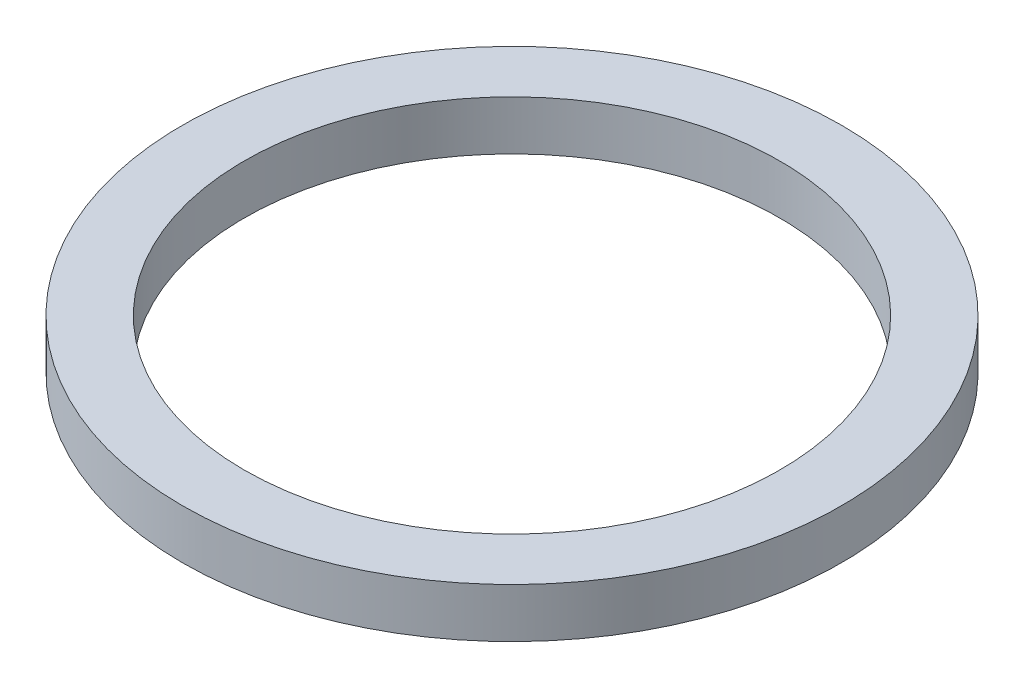
from build123d import *

# Parameters (mm, degrees)
SKETCH1_R           = 40
BOSS_EXTRUDE1_DEPTH = 6
SKETCH2_R           = 32.5
CUT_EXTRUDE1_DEPTH  = 57.885850613


with BuildPart() as part:
    # Sketch1 → Boss-Extrude1 (new body)
    with BuildSketch(Plane(origin=(0, 0, 0), x_dir=(1, 0, 0), z_dir=(0, 1, 0))):
        Circle(SKETCH1_R)
    extrude(amount=BOSS_EXTRUDE1_DEPTH)

    # Sketch2 → Cut-Extrude1 (cut, through all)
    with BuildSketch(Plane(origin=(0, 0, 0), x_dir=(1, 0, 0), z_dir=(0, 1, 0))):
        Circle(SKETCH2_R)
    extrude(amount=CUT_EXTRUDE1_DEPTH, mode=Mode.SUBTRACT)


solid = part.part
